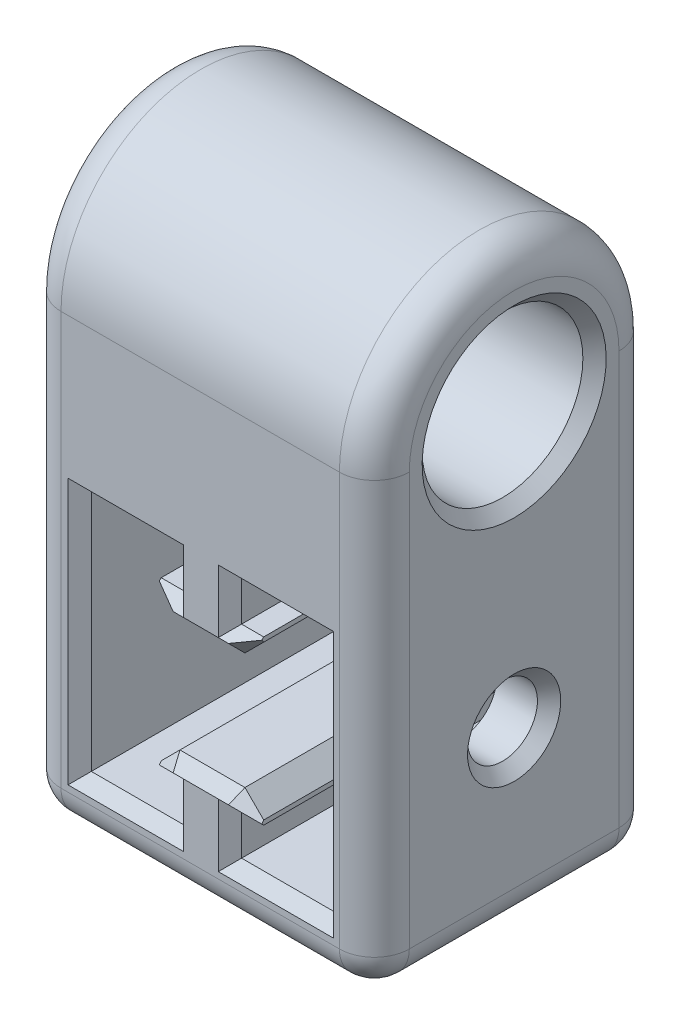
from build123d import *

# Parameters (mm, degrees)
BOSS_EXTRUDE1_DEPTH = 24
SKETCH5_R           = 6.9
BOSS_EXTRUDE3_DEPTH = 29.899298
SKETCH3_R           = 3
CUT_EXTRUDE1_DEPTH  = 53.251488462
SKETCH6_R           = 12
SKETCH6_R_2         = 5
BOSS_EXTRUDE4_DEPTH = 4
FILLET1_R           = 3
CHAMFER1_SIZE       = 1


with BuildPart() as part:
    # Sketch1 → Boss-Extrude1 (new body)
    with BuildSketch(Plane.XY):
        Polygon((0, 15), (14.899298428, 15), (14.899298428, -14.949649214), (-15, -14.949649214), (-15, 15), align=None)
        Polygon((-10.4, 10.4), (-2.5, 10.4), (-2.5, 7), (-4.4, 7), (-4.4, 6.61), (-2.79, 5), (2.79, 5), (4.4, 6.61), (4.4, 7), (2.5, 7), (2.5, 10.4), (10.4, 10.4), (10.4, 2.933567191), (10.4, -2.933567191), (10.4, -10.4), (2.5, -10.4), (2.5, -7), (4.4, -7), (4.4, -6.61), (2.79, -5), (-2.79, -5), (-4.4, -6.61), (-4.4, -7), (-2.5, -7), (-2.5, -10.4), (-10.4, -10.4), (-10.4, -2.933567191), (-10.4, -2.61), (-10.4, 2.933567191), align=None, mode=Mode.SUBTRACT)
    extrude(amount=BOSS_EXTRUDE1_DEPTH)

    # Sketch5 → Boss-Extrude3 (add, through all)
    with BuildSketch(Plane.ZY.offset(15)):
        with BuildLine():
            Line((0, 15), (24, 15))
            Line((24, 15), (24, 23.5))
            ThreePointArc((24, 23.5), (12, 35.5), (0, 23.5))
            Line((0, 23.5), (0, 15))
        make_face()
        with Locations((12, 23.5)):
            Circle(SKETCH5_R, mode=Mode.SUBTRACT)
    extrude(amount=-BOSS_EXTRUDE3_DEPTH)

    # Sketch3 → Cut-Extrude1 (cut, through all)
    with BuildSketch(Plane.ZY.offset(15)):
        with Locations((12, 0)):
            Circle(SKETCH3_R)
    extrude(amount=-CUT_EXTRUDE1_DEPTH, mode=Mode.SUBTRACT)

    # Sketch6 → Boss-Extrude4 (add)
    with BuildSketch(Plane.ZY.offset(15)):
        with Locations((12, 23.5)):
            Circle(SKETCH6_R)
        with Locations((12, 23.5)):
            Circle(SKETCH6_R_2, mode=Mode.SUBTRACT)
    extrude(amount=-BOSS_EXTRUDE4_DEPTH)

    # Fillet1
    fillet1_edges = [part.edges().sort_by_distance(p)[0] for p in [
        (-0.050350786, -14.949649214, 24),
        (14.899298428, 0.025175393, 24),
        (14.899298428, 0.025175393, 0),
        (-0.050350786, -14.949649214, 0),
        (-15, 4.275175393, 0),
        (-15, 4.275175393, 24),
        (14.899298428, -14.949649214, 12),
        (-15, -14.949649214, 12),
        (14.899298, 35.5, 12),
        (-15, 35.5, 12),
    ]]
    fillet(fillet1_edges, radius=FILLET1_R)

    # Chamfer1
    # the kernel refuses this chamfer: 1 mm, written as the material it takes off along each edge
    with BuildSketch(Plane(origin=(-15, 0, 12), x_dir=(0, 0, 1), z_dir=(0, -1, 0))) as chamfer1_piece_1:
        Polygon((3 + CHAMFER1_SIZE, 0), (3, -CHAMFER1_SIZE), (3, 0), align=None)
    revolve(axis=Axis((-15, 0, 12), (-1, 0, 0)), mode=Mode.SUBTRACT)
    with BuildSketch(Plane(origin=(14.899298428, 0, 12), x_dir=(0, 0, 1), z_dir=(0, -1, 0))) as chamfer1_piece_2:
        Polygon((3 + CHAMFER1_SIZE, 0), (3, CHAMFER1_SIZE), (3, 0), align=None)
    revolve(axis=Axis((14.899298428, 0, 12), (-1, 0, 0)), mode=Mode.SUBTRACT)
    with BuildSketch(Plane(origin=(14.899298, 23.5, 12), x_dir=(0, 0, 1), z_dir=(0, -1, 0))) as chamfer1_piece_3:
        Polygon((6.9 + CHAMFER1_SIZE, 0), (6.9, CHAMFER1_SIZE), (6.9, 0), align=None)
    revolve(axis=Axis((14.899298, 23.5, 12), (-1, 0, 0)), mode=Mode.SUBTRACT)
    with BuildSketch(Plane(origin=(-6.21845448, 8.42845448, 0), x_dir=(-0.019442520806012883, -0.01944252080601297, 0.9996219169112968), z_dir=(0.7071067811865491, -0.707106781186546, 0)), Plane(origin=(0.97154552, 3.18154552, 0), x_dir=(0.01944252080601412, -0.019442520806014222, 0.9996219169112968), z_dir=(0.7071067811865493, 0.7071067811865458, 0)), Plane(origin=(6.21845448, -8.42845448, 0), x_dir=(0.019442520806013733, 0.019442520806013854, 0.9996219169112968), z_dir=(-0.7071067811865498, 0.7071067811865452, 0)), Plane(origin=(-0.97154552, -3.18154552, 0), x_dir=(-0.019442520806014107, 0.019442520806014236, 0.9996219169112968), z_dir=(-0.7071067811865498, -0.7071067811865452, 0)), Plane(origin=(-0.97154552, -3.18154552, 24), x_dir=(0.7068394360706712, -0.7068394360706757, 0.02749587661058563), z_dir=(-0.7071067811865498, -0.7071067811865452, 0)), Plane(origin=(6.21845448, -8.42845448, 24), x_dir=(-0.7068394360706712, -0.7068394360706758, 0.027495876610585647), z_dir=(-0.7071067811865498, 0.7071067811865452, 0)), Plane(origin=(0.97154552, 3.18154552, 24), x_dir=(-0.7068394360706717, 0.7068394360706753, 0.02749587661058563), z_dir=(0.7071067811865493, 0.7071067811865458, 0)), Plane(origin=(-6.21845448, 8.42845448, 24), x_dir=(0.706839436070672, 0.706839436070675, 0.02749587661058563), z_dir=(0.7071067811865491, -0.707106781186546, 0))) as chamfer1_piece_4:
        Polygon((CHAMFER1_SIZE * 0.999621916911, -CHAMFER1_SIZE * 0.0274958766106), (-CHAMFER1_SIZE * 0.0274958766106, -CHAMFER1_SIZE * 0.999621916911), (0, 0), align=None)
    extrude(amount=7.420249811, mode=Mode.SUBTRACT)
    with BuildSketch(Plane(origin=(-5.361682988, 5, 0), x_dir=(0, -0.027495876610586494, 0.9996219169112968), z_dir=(1, 0, 0)), Plane(origin=(5.361682988, -5, 0), x_dir=(0, 0.027495876610586494, 0.9996219169112968), z_dir=(-1, 0, 0)), Plane(origin=(5.361682988, -5, 24), x_dir=(0, -0.9996219169112968, 0.027495876610585623), z_dir=(-1, 0, 0)), Plane(origin=(-5.361682988, 5, 24), x_dir=(0, 0.9996219169112968, 0.027495876610585623), z_dir=(1, 0, 0))) as chamfer1_piece_5:
        Polygon((CHAMFER1_SIZE * 0.999621916911, -CHAMFER1_SIZE * 0.0274958766106), (-CHAMFER1_SIZE * 0.0274958766106, -CHAMFER1_SIZE * 0.999621916911), (0, 0), align=None)
    extrude(amount=10.723365976, mode=Mode.SUBTRACT)
    with BuildSketch(Plane(origin=(6.971682988, 7, 0), x_dir=(0, 0.027495876610586494, 0.9996219169112968), z_dir=(-1, 0, 0)), Plane(origin=(2.5, -7, 0), x_dir=(0, -0.027495876610586494, 0.9996219169112968), z_dir=(1, 0, 0)), Plane(origin=(-6.971682988, -7, 0), x_dir=(0, -0.027495876610586494, 0.9996219169112968), z_dir=(1, 0, 0)), Plane(origin=(-2.5, 7, 0), x_dir=(0, 0.027495876610586494, 0.9996219169112968), z_dir=(-1, 0, 0)), Plane(origin=(-6.971682988, -7, 24), x_dir=(1.4018567596735031e-15, 0.9996219169112968, 0.027495876610585623), z_dir=(1, 0, 0)), Plane(origin=(2.5, -7, 24), x_dir=(-1.4018567596735031e-15, 0.9996219169112968, 0.027495876610585623), z_dir=(1, 0, 0)), Plane(origin=(6.971682988, 7, 24), x_dir=(0, -0.9996219169112968, 0.027495876610585623), z_dir=(-1, 0, 0)), Plane(origin=(-2.5, 7, 24), x_dir=(0, -0.9996219169112968, 0.027495876610585623), z_dir=(-1, 0, 0))) as chamfer1_piece_6:
        Polygon((CHAMFER1_SIZE * 0.999621916911, -CHAMFER1_SIZE * 0.0274958766106), (-CHAMFER1_SIZE * 0.0274958766106, -CHAMFER1_SIZE * 0.999621916911), (0, 0), align=None)
    extrude(amount=4.471682988, mode=Mode.SUBTRACT)
    with BuildSketch(Plane(origin=(2.5, 7, 0), x_dir=(0.027495876610586494, 0, 0.9996219169112968), z_dir=(0, 1, 0)), Plane(origin=(2.5, -10.4, 0), x_dir=(0.027495876610586494, 0, 0.9996219169112968), z_dir=(0, 1, 0)), Plane(origin=(-2.5, -7, 0), x_dir=(-0.027495876610586494, 0, 0.9996219169112968), z_dir=(0, -1, 0)), Plane(origin=(-2.5, 10.4, 0), x_dir=(-0.027495876610586494, 0, 0.9996219169112968), z_dir=(0, -1, 0)), Plane(origin=(-2.5, 10.4, 24), x_dir=(0.9996219169112968, 1.5145550481962746e-14, 0.02749587661058563), z_dir=(0, -1, 0)), Plane(origin=(-2.5, -7, 24), x_dir=(0.9996219169112968, 1.488442030123925e-14, 0.02749587661058563), z_dir=(0, -1, 0)), Plane(origin=(2.5, -10.4, 24), x_dir=(-0.9996219169112968, 1.488442030123925e-14, 0.02749587661058563), z_dir=(0, 1, 0)), Plane(origin=(2.5, 7, 24), x_dir=(-0.9996219169112968, -1.5145550481962746e-14, 0.02749587661058563), z_dir=(0, 1, 0))) as chamfer1_piece_7:
        Polygon((CHAMFER1_SIZE * 0.999621916911, -CHAMFER1_SIZE * 0.0274958766106), (-CHAMFER1_SIZE * 0.0274958766106, -CHAMFER1_SIZE * 0.999621916911), (0, 0), align=None)
    extrude(amount=3.4, mode=Mode.SUBTRACT)
    with BuildSketch(Plane(origin=(2.5, 10.4, 0), x_dir=(0, -0.02749587661058563, 0.9996219169112968), z_dir=(1, 0, 0)), Plane(origin=(10.4, -10.4, 0), x_dir=(0, 0.02749587661058563, 0.9996219169112968), z_dir=(-1, 0, 0)), Plane(origin=(-2.5, -10.4, 0), x_dir=(0, 0.02749587661058563, 0.9996219169112968), z_dir=(-1, 0, 0)), Plane(origin=(-10.4, 10.4, 0), x_dir=(0, -0.02749587661058563, 0.9996219169112968), z_dir=(1, 0, 0)), Plane(origin=(-10.4, 10.4, 24), x_dir=(0, 0.9996219169112968, 0.027495876610585647), z_dir=(1, 0, 0)), Plane(origin=(-2.5, -10.4, 24), x_dir=(0, -0.9996219169112968, 0.027495876610585647), z_dir=(-1, 0, 0)), Plane(origin=(10.4, -10.4, 24), x_dir=(0, -0.9996219169112968, 0.027495876610585647), z_dir=(-1, 0, 0)), Plane(origin=(2.5, 10.4, 24), x_dir=(0, 0.9996219169112968, 0.027495876610585647), z_dir=(1, 0, 0))) as chamfer1_piece_8:
        Polygon((CHAMFER1_SIZE * 0.999621916911, -CHAMFER1_SIZE * 0.0274958766106), (-CHAMFER1_SIZE * 0.0274958766106, -CHAMFER1_SIZE * 0.999621916911), (0, 0), align=None)
    extrude(amount=7.9, mode=Mode.SUBTRACT)
    with BuildSketch(Plane(origin=(10.4, 10.4, 0), x_dir=(-0.02749587661058908, 0, 0.9996219169112968), z_dir=(0, -1, 0)), Plane(origin=(-10.4, -10.4, 0), x_dir=(0.027495876610587354, 0, 0.9996219169112968), z_dir=(0, 1, 0))) as chamfer1_piece_9:
        Polygon((CHAMFER1_SIZE * 0.999621916911, -CHAMFER1_SIZE * 0.0274958766106), (-CHAMFER1_SIZE * 0.0274958766106, -CHAMFER1_SIZE * 0.999621916911), (0, 0), align=None)
    extrude(amount=20.8, mode=Mode.SUBTRACT)
    with BuildSketch(Plane(origin=(-10.4, 10.4, 24), x_dir=(-0.9996219169112968, 0, 0.027495876610585647), z_dir=(0, -1, 0)), Plane(origin=(10.4, -10.4, 24), x_dir=(0.9996219169112968, 0, 0.027495876610585647), z_dir=(0, 1, 0))) as chamfer1_piece_10:
        Polygon((CHAMFER1_SIZE * 0.999621916911, CHAMFER1_SIZE * 0.0274958766106), (-CHAMFER1_SIZE * 0.0274958766106, CHAMFER1_SIZE * 0.999621916911), (0, 0), align=None)
    extrude(amount=20.8, mode=Mode.SUBTRACT)
    with BuildSketch(Plane(origin=(-15, 23.5, 12), x_dir=(0, 0, 1), z_dir=(0, -1, 0))) as chamfer1_piece_11:
        Polygon((5 + CHAMFER1_SIZE, 0), (5, -CHAMFER1_SIZE), (5, 0), align=None)
    revolve(axis=Axis((-15, 23.5, 12), (-1, 0, 0)), mode=Mode.SUBTRACT)
    with BuildSketch(Plane(origin=(2.5, 4.428317012, 0), x_dir=(0.027495876610586494, 0, 0.9996219169112968), z_dir=(0, 1, 0))) as chamfer1_piece_12a_section:
        Polygon((CHAMFER1_SIZE * 0.999621916911, -CHAMFER1_SIZE * 0.0274958766106), (-CHAMFER1_SIZE * 0.0274958766106, -CHAMFER1_SIZE * 0.999621916911), (0, 0), align=None)
    chamfer1_piece_12a = extrude(amount=5.971682988, mode=Mode.PRIVATE)
    chamfer1_piece_12a = split(chamfer1_piece_12a, bisect_by=Plane(origin=(2.170206373, 7, 0.329793627), z_dir=(0, -1, 0)), keep=Keep.TOP, mode=Mode.PRIVATE)
    with BuildSketch(Plane(origin=(6.971682988, 7, 0), x_dir=(0, 0.027495876610586494, 0.9996219169112968), z_dir=(-1, 0, 0))) as chamfer1_piece_12b_section:
        Polygon((CHAMFER1_SIZE * 0.999621916911, -CHAMFER1_SIZE * 0.0274958766106), (-CHAMFER1_SIZE * 0.0274958766106, -CHAMFER1_SIZE * 0.999621916911), (0, 0), align=None)
    chamfer1_piece_12b = extrude(amount=7.043365976, mode=Mode.PRIVATE)
    chamfer1_piece_12b = split(chamfer1_piece_12b, bisect_by=Plane(origin=(2.5, 6.670206373, 0.329793627), z_dir=(-1, 0, 0)), keep=Keep.TOP, mode=Mode.PRIVATE)
    chamfer1_piece_12 = chamfer1_piece_12a & chamfer1_piece_12b
    add(chamfer1_piece_12, mode=Mode.SUBTRACT)
    with BuildSketch(Plane(origin=(-0.071682988, 10.4, 0), x_dir=(0, -0.02749587661058563, 0.9996219169112968), z_dir=(1, 0, 0))) as chamfer1_piece_13a_section:
        Polygon((CHAMFER1_SIZE * 0.999621916911, -CHAMFER1_SIZE * 0.0274958766106), (-CHAMFER1_SIZE * 0.0274958766106, -CHAMFER1_SIZE * 0.999621916911), (0, 0), align=None)
    chamfer1_piece_13a = extrude(amount=10.471682988, mode=Mode.PRIVATE)
    chamfer1_piece_13a = split(chamfer1_piece_13a, bisect_by=Plane(origin=(2.5, 10.729793627, 0.329793627), z_dir=(-1, 0, 0)), keep=Keep.TOP, mode=Mode.PRIVATE)
    with BuildSketch(Plane(origin=(2.5, 7, 0), x_dir=(0.027495876610586494, 0, 0.9996219169112968), z_dir=(0, 1, 0))) as chamfer1_piece_13b_section:
        Polygon((CHAMFER1_SIZE * 0.999621916911, -CHAMFER1_SIZE * 0.0274958766106), (-CHAMFER1_SIZE * 0.0274958766106, -CHAMFER1_SIZE * 0.999621916911), (0, 0), align=None)
    chamfer1_piece_13b = extrude(amount=5.971682988, mode=Mode.PRIVATE)
    chamfer1_piece_13b = split(chamfer1_piece_13b, bisect_by=Plane(origin=(2.170206373, 10.4, 0.329793627), z_dir=(0, 1, 0)), keep=Keep.TOP, mode=Mode.PRIVATE)
    chamfer1_piece_13 = chamfer1_piece_13a & chamfer1_piece_13b
    add(chamfer1_piece_13, mode=Mode.SUBTRACT)
    with BuildSketch(Plane(origin=(10.4, 12.971682988, 0), x_dir=(-0.02749587661058563, 0, 0.9996219169112968), z_dir=(0, -1, 0))) as chamfer1_piece_14a_section:
        Polygon((CHAMFER1_SIZE * 0.999621916911, -CHAMFER1_SIZE * 0.0274958766106), (-CHAMFER1_SIZE * 0.0274958766106, -CHAMFER1_SIZE * 0.999621916911), (0, 0), align=None)
    chamfer1_piece_14a = extrude(amount=23.371682988, mode=Mode.PRIVATE)
    chamfer1_piece_14a = split(chamfer1_piece_14a, bisect_by=Plane(origin=(10.729793627, 10.4, 0.329793627), z_dir=(0, 1, 0)), keep=Keep.TOP, mode=Mode.PRIVATE)
    with BuildSketch(Plane(origin=(2.5, 10.4, 0), x_dir=(0, -0.02749587661058563, 0.9996219169112968), z_dir=(1, 0, 0))) as chamfer1_piece_14b_section:
        Polygon((CHAMFER1_SIZE * 0.999621916911, -CHAMFER1_SIZE * 0.0274958766106), (-CHAMFER1_SIZE * 0.0274958766106, -CHAMFER1_SIZE * 0.999621916911), (0, 0), align=None)
    chamfer1_piece_14b = extrude(amount=10.471682988, mode=Mode.PRIVATE)
    chamfer1_piece_14b = split(chamfer1_piece_14b, bisect_by=Plane(origin=(10.4, 10.729793627, 0.329793627), z_dir=(1, 0, 0)), keep=Keep.TOP, mode=Mode.PRIVATE)
    chamfer1_piece_14 = chamfer1_piece_14a & chamfer1_piece_14b
    add(chamfer1_piece_14, mode=Mode.SUBTRACT)
    with BuildSketch(Plane(origin=(12.971682988, -10.4, 0), x_dir=(0, 0.02749587661058563, 0.9996219169112968), z_dir=(-1, 0, 0))) as chamfer1_piece_15a_section:
        Polygon((CHAMFER1_SIZE * 0.999621916911, -CHAMFER1_SIZE * 0.0274958766106), (-CHAMFER1_SIZE * 0.0274958766106, -CHAMFER1_SIZE * 0.999621916911), (0, 0), align=None)
    chamfer1_piece_15a = extrude(amount=10.471682988, mode=Mode.PRIVATE)
    chamfer1_piece_15a = split(chamfer1_piece_15a, bisect_by=Plane(origin=(10.4, -10.729793627, 0.329793627), z_dir=(1, 0, 0)), keep=Keep.TOP, mode=Mode.PRIVATE)
    with BuildSketch(Plane(origin=(10.4, 10.4, 0), x_dir=(-0.02749587661058908, 0, 0.9996219169112968), z_dir=(0, -1, 0))) as chamfer1_piece_15b_section:
        Polygon((CHAMFER1_SIZE * 0.999621916911, -CHAMFER1_SIZE * 0.0274958766106), (-CHAMFER1_SIZE * 0.0274958766106, -CHAMFER1_SIZE * 0.999621916911), (0, 0), align=None)
    chamfer1_piece_15b = extrude(amount=23.371682988, mode=Mode.PRIVATE)
    chamfer1_piece_15b = split(chamfer1_piece_15b, bisect_by=Plane(origin=(10.729793627, -10.4, 0.329793627), z_dir=(0, -1, 0)), keep=Keep.TOP, mode=Mode.PRIVATE)
    chamfer1_piece_15 = chamfer1_piece_15a & chamfer1_piece_15b
    add(chamfer1_piece_15, mode=Mode.SUBTRACT)
    with BuildSketch(Plane(origin=(2.5, -12.971682988, 0), x_dir=(0.027495876610586494, 0, 0.9996219169112968), z_dir=(0, 1, 0))) as chamfer1_piece_16a_section:
        Polygon((CHAMFER1_SIZE * 0.999621916911, -CHAMFER1_SIZE * 0.0274958766106), (-CHAMFER1_SIZE * 0.0274958766106, -CHAMFER1_SIZE * 0.999621916911), (0, 0), align=None)
    chamfer1_piece_16a = extrude(amount=5.971682988, mode=Mode.PRIVATE)
    chamfer1_piece_16a = split(chamfer1_piece_16a, bisect_by=Plane(origin=(2.170206373, -10.4, 0.329793627), z_dir=(0, -1, 0)), keep=Keep.TOP, mode=Mode.PRIVATE)
    with BuildSketch(Plane(origin=(10.4, -10.4, 0), x_dir=(0, 0.02749587661058563, 0.9996219169112968), z_dir=(-1, 0, 0))) as chamfer1_piece_16b_section:
        Polygon((CHAMFER1_SIZE * 0.999621916911, -CHAMFER1_SIZE * 0.0274958766106), (-CHAMFER1_SIZE * 0.0274958766106, -CHAMFER1_SIZE * 0.999621916911), (0, 0), align=None)
    chamfer1_piece_16b = extrude(amount=10.471682988, mode=Mode.PRIVATE)
    chamfer1_piece_16b = split(chamfer1_piece_16b, bisect_by=Plane(origin=(2.5, -10.729793627, 0.329793627), z_dir=(-1, 0, 0)), keep=Keep.TOP, mode=Mode.PRIVATE)
    chamfer1_piece_16 = chamfer1_piece_16a & chamfer1_piece_16b
    add(chamfer1_piece_16, mode=Mode.SUBTRACT)
    with BuildSketch(Plane(origin=(-0.071682988, -7, 0), x_dir=(0, -0.027495876610586494, 0.9996219169112968), z_dir=(1, 0, 0))) as chamfer1_piece_17a_section:
        Polygon((CHAMFER1_SIZE * 0.999621916911, -CHAMFER1_SIZE * 0.0274958766106), (-CHAMFER1_SIZE * 0.0274958766106, -CHAMFER1_SIZE * 0.999621916911), (0, 0), align=None)
    chamfer1_piece_17a = extrude(amount=7.043365976, mode=Mode.PRIVATE)
    chamfer1_piece_17a = split(chamfer1_piece_17a, bisect_by=Plane(origin=(2.5, -6.670206373, 0.329793627), z_dir=(-1, 0, 0)), keep=Keep.TOP, mode=Mode.PRIVATE)
    with BuildSketch(Plane(origin=(2.5, -10.4, 0), x_dir=(0.027495876610586494, 0, 0.9996219169112968), z_dir=(0, 1, 0))) as chamfer1_piece_17b_section:
        Polygon((CHAMFER1_SIZE * 0.999621916911, -CHAMFER1_SIZE * 0.0274958766106), (-CHAMFER1_SIZE * 0.0274958766106, -CHAMFER1_SIZE * 0.999621916911), (0, 0), align=None)
    chamfer1_piece_17b = extrude(amount=5.971682988, mode=Mode.PRIVATE)
    chamfer1_piece_17b = split(chamfer1_piece_17b, bisect_by=Plane(origin=(2.170206373, -7, 0.329793627), z_dir=(0, 1, 0)), keep=Keep.TOP, mode=Mode.PRIVATE)
    chamfer1_piece_17 = chamfer1_piece_17a & chamfer1_piece_17b
    add(chamfer1_piece_17, mode=Mode.SUBTRACT)
    with BuildSketch(Plane(origin=(-2.5, -4.428317012, 0), x_dir=(-0.027495876610586494, 0, 0.9996219169112968), z_dir=(0, -1, 0))) as chamfer1_piece_18a_section:
        Polygon((CHAMFER1_SIZE * 0.999621916911, -CHAMFER1_SIZE * 0.0274958766106), (-CHAMFER1_SIZE * 0.0274958766106, -CHAMFER1_SIZE * 0.999621916911), (0, 0), align=None)
    chamfer1_piece_18a = extrude(amount=5.971682988, mode=Mode.PRIVATE)
    chamfer1_piece_18a = split(chamfer1_piece_18a, bisect_by=Plane(origin=(-2.170206373, -7, 0.329793627), z_dir=(0, 1, 0)), keep=Keep.TOP, mode=Mode.PRIVATE)
    with BuildSketch(Plane(origin=(-6.971682988, -7, 0), x_dir=(0, -0.027495876610586494, 0.9996219169112968), z_dir=(1, 0, 0))) as chamfer1_piece_18b_section:
        Polygon((CHAMFER1_SIZE * 0.999621916911, -CHAMFER1_SIZE * 0.0274958766106), (-CHAMFER1_SIZE * 0.0274958766106, -CHAMFER1_SIZE * 0.999621916911), (0, 0), align=None)
    chamfer1_piece_18b = extrude(amount=7.043365976, mode=Mode.PRIVATE)
    chamfer1_piece_18b = split(chamfer1_piece_18b, bisect_by=Plane(origin=(-2.5, -6.670206373, 0.329793627), z_dir=(1, 0, 0)), keep=Keep.TOP, mode=Mode.PRIVATE)
    chamfer1_piece_18 = chamfer1_piece_18a & chamfer1_piece_18b
    add(chamfer1_piece_18, mode=Mode.SUBTRACT)
    with BuildSketch(Plane(origin=(0.071682988, -10.4, 0), x_dir=(0, 0.02749587661058563, 0.9996219169112968), z_dir=(-1, 0, 0))) as chamfer1_piece_19a_section:
        Polygon((CHAMFER1_SIZE * 0.999621916911, -CHAMFER1_SIZE * 0.0274958766106), (-CHAMFER1_SIZE * 0.0274958766106, -CHAMFER1_SIZE * 0.999621916911), (0, 0), align=None)
    chamfer1_piece_19a = extrude(amount=10.471682988, mode=Mode.PRIVATE)
    chamfer1_piece_19a = split(chamfer1_piece_19a, bisect_by=Plane(origin=(-2.5, -10.729793627, 0.329793627), z_dir=(1, 0, 0)), keep=Keep.TOP, mode=Mode.PRIVATE)
    with BuildSketch(Plane(origin=(-2.5, -7, 0), x_dir=(-0.027495876610586494, 0, 0.9996219169112968), z_dir=(0, -1, 0))) as chamfer1_piece_19b_section:
        Polygon((CHAMFER1_SIZE * 0.999621916911, -CHAMFER1_SIZE * 0.0274958766106), (-CHAMFER1_SIZE * 0.0274958766106, -CHAMFER1_SIZE * 0.999621916911), (0, 0), align=None)
    chamfer1_piece_19b = extrude(amount=5.971682988, mode=Mode.PRIVATE)
    chamfer1_piece_19b = split(chamfer1_piece_19b, bisect_by=Plane(origin=(-2.170206373, -10.4, 0.329793627), z_dir=(0, -1, 0)), keep=Keep.TOP, mode=Mode.PRIVATE)
    chamfer1_piece_19 = chamfer1_piece_19a & chamfer1_piece_19b
    add(chamfer1_piece_19, mode=Mode.SUBTRACT)
    with BuildSketch(Plane(origin=(-10.4, -12.971682988, 0), x_dir=(0.02749587661058563, 0, 0.9996219169112968), z_dir=(0, 1, 0))) as chamfer1_piece_20a_section:
        Polygon((CHAMFER1_SIZE * 0.999621916911, -CHAMFER1_SIZE * 0.0274958766106), (-CHAMFER1_SIZE * 0.0274958766106, -CHAMFER1_SIZE * 0.999621916911), (0, 0), align=None)
    chamfer1_piece_20a = extrude(amount=23.371682988, mode=Mode.PRIVATE)
    chamfer1_piece_20a = split(chamfer1_piece_20a, bisect_by=Plane(origin=(-10.729793627, -10.4, 0.329793627), z_dir=(0, -1, 0)), keep=Keep.TOP, mode=Mode.PRIVATE)
    with BuildSketch(Plane(origin=(-2.5, -10.4, 0), x_dir=(0, 0.02749587661058563, 0.9996219169112968), z_dir=(-1, 0, 0))) as chamfer1_piece_20b_section:
        Polygon((CHAMFER1_SIZE * 0.999621916911, -CHAMFER1_SIZE * 0.0274958766106), (-CHAMFER1_SIZE * 0.0274958766106, -CHAMFER1_SIZE * 0.999621916911), (0, 0), align=None)
    chamfer1_piece_20b = extrude(amount=10.471682988, mode=Mode.PRIVATE)
    chamfer1_piece_20b = split(chamfer1_piece_20b, bisect_by=Plane(origin=(-10.4, -10.729793627, 0.329793627), z_dir=(-1, 0, 0)), keep=Keep.TOP, mode=Mode.PRIVATE)
    chamfer1_piece_20 = chamfer1_piece_20a & chamfer1_piece_20b
    add(chamfer1_piece_20, mode=Mode.SUBTRACT)
    with BuildSketch(Plane(origin=(-10.4, -10.4, 0), x_dir=(0.027495876610587354, 0, 0.9996219169112968), z_dir=(0, 1, 0))) as chamfer1_piece_21a_section:
        Polygon((CHAMFER1_SIZE * 0.999621916911, -CHAMFER1_SIZE * 0.0274958766106), (-CHAMFER1_SIZE * 0.0274958766106, -CHAMFER1_SIZE * 0.999621916911), (0, 0), align=None)
    chamfer1_piece_21a = extrude(amount=23.371682988, mode=Mode.PRIVATE)
    chamfer1_piece_21a = split(chamfer1_piece_21a, bisect_by=Plane(origin=(-10.729793627, 10.4, 0.329793627), z_dir=(0, 1, 0)), keep=Keep.TOP, mode=Mode.PRIVATE)
    with BuildSketch(Plane(origin=(-12.971682988, 10.4, 0), x_dir=(0, -0.02749587661058563, 0.9996219169112968), z_dir=(1, 0, 0))) as chamfer1_piece_21b_section:
        Polygon((CHAMFER1_SIZE * 0.999621916911, -CHAMFER1_SIZE * 0.0274958766106), (-CHAMFER1_SIZE * 0.0274958766106, -CHAMFER1_SIZE * 0.999621916911), (0, 0), align=None)
    chamfer1_piece_21b = extrude(amount=10.471682988, mode=Mode.PRIVATE)
    chamfer1_piece_21b = split(chamfer1_piece_21b, bisect_by=Plane(origin=(-10.4, 10.729793627, 0.329793627), z_dir=(-1, 0, 0)), keep=Keep.TOP, mode=Mode.PRIVATE)
    chamfer1_piece_21 = chamfer1_piece_21a & chamfer1_piece_21b
    add(chamfer1_piece_21, mode=Mode.SUBTRACT)
    with BuildSketch(Plane(origin=(-2.5, 12.971682988, 0), x_dir=(-0.027495876610586494, 0, 0.9996219169112968), z_dir=(0, -1, 0))) as chamfer1_piece_22a_section:
        Polygon((CHAMFER1_SIZE * 0.999621916911, -CHAMFER1_SIZE * 0.0274958766106), (-CHAMFER1_SIZE * 0.0274958766106, -CHAMFER1_SIZE * 0.999621916911), (0, 0), align=None)
    chamfer1_piece_22a = extrude(amount=5.971682988, mode=Mode.PRIVATE)
    chamfer1_piece_22a = split(chamfer1_piece_22a, bisect_by=Plane(origin=(-2.170206373, 10.4, 0.329793627), z_dir=(0, 1, 0)), keep=Keep.TOP, mode=Mode.PRIVATE)
    with BuildSketch(Plane(origin=(-10.4, 10.4, 0), x_dir=(0, -0.02749587661058563, 0.9996219169112968), z_dir=(1, 0, 0))) as chamfer1_piece_22b_section:
        Polygon((CHAMFER1_SIZE * 0.999621916911, -CHAMFER1_SIZE * 0.0274958766106), (-CHAMFER1_SIZE * 0.0274958766106, -CHAMFER1_SIZE * 0.999621916911), (0, 0), align=None)
    chamfer1_piece_22b = extrude(amount=10.471682988, mode=Mode.PRIVATE)
    chamfer1_piece_22b = split(chamfer1_piece_22b, bisect_by=Plane(origin=(-2.5, 10.729793627, 0.329793627), z_dir=(1, 0, 0)), keep=Keep.TOP, mode=Mode.PRIVATE)
    chamfer1_piece_22 = chamfer1_piece_22a & chamfer1_piece_22b
    add(chamfer1_piece_22, mode=Mode.SUBTRACT)
    with BuildSketch(Plane(origin=(0.071682988, 7, 0), x_dir=(0, 0.027495876610586494, 0.9996219169112968), z_dir=(-1, 0, 0))) as chamfer1_piece_23a_section:
        Polygon((CHAMFER1_SIZE * 0.999621916911, -CHAMFER1_SIZE * 0.0274958766106), (-CHAMFER1_SIZE * 0.0274958766106, -CHAMFER1_SIZE * 0.999621916911), (0, 0), align=None)
    chamfer1_piece_23a = extrude(amount=7.043365976, mode=Mode.PRIVATE)
    chamfer1_piece_23a = split(chamfer1_piece_23a, bisect_by=Plane(origin=(-2.5, 6.670206373, 0.329793627), z_dir=(1, 0, 0)), keep=Keep.TOP, mode=Mode.PRIVATE)
    with BuildSketch(Plane(origin=(-2.5, 10.4, 0), x_dir=(-0.027495876610586494, 0, 0.9996219169112968), z_dir=(0, -1, 0))) as chamfer1_piece_23b_section:
        Polygon((CHAMFER1_SIZE * 0.999621916911, -CHAMFER1_SIZE * 0.0274958766106), (-CHAMFER1_SIZE * 0.0274958766106, -CHAMFER1_SIZE * 0.999621916911), (0, 0), align=None)
    chamfer1_piece_23b = extrude(amount=5.971682988, mode=Mode.PRIVATE)
    chamfer1_piece_23b = split(chamfer1_piece_23b, bisect_by=Plane(origin=(-2.170206373, 7, 0.329793627), z_dir=(0, -1, 0)), keep=Keep.TOP, mode=Mode.PRIVATE)
    chamfer1_piece_23 = chamfer1_piece_23a & chamfer1_piece_23b
    add(chamfer1_piece_23, mode=Mode.SUBTRACT)
    with BuildSketch(Plane(origin=(-2.5, 12.971682988, 24), x_dir=(0.9996219169112968, 1.5145550481962746e-14, 0.02749587661058563), z_dir=(0, -1, 0))) as chamfer1_piece_24a_section:
        Polygon((CHAMFER1_SIZE * 0.999621916911, -CHAMFER1_SIZE * 0.0274958766106), (-CHAMFER1_SIZE * 0.0274958766106, -CHAMFER1_SIZE * 0.999621916911), (0, 0), align=None)
    chamfer1_piece_24a = extrude(amount=5.971682988, mode=Mode.PRIVATE)
    chamfer1_piece_24a = split(chamfer1_piece_24a, bisect_by=Plane(origin=(-2.170206373, 10.4, 23.670206373), z_dir=(0, 1, 0)), keep=Keep.TOP, mode=Mode.PRIVATE)
    with BuildSketch(Plane(origin=(-10.4, 10.4, 24), x_dir=(0, 0.9996219169112968, 0.027495876610585647), z_dir=(1, 0, 0))) as chamfer1_piece_24b_section:
        Polygon((CHAMFER1_SIZE * 0.999621916911, -CHAMFER1_SIZE * 0.0274958766106), (-CHAMFER1_SIZE * 0.0274958766106, -CHAMFER1_SIZE * 0.999621916911), (0, 0), align=None)
    chamfer1_piece_24b = extrude(amount=10.471682988, mode=Mode.PRIVATE)
    chamfer1_piece_24b = split(chamfer1_piece_24b, bisect_by=Plane(origin=(-2.5, 10.729793627, 23.670206373), z_dir=(1, 0, 0)), keep=Keep.TOP, mode=Mode.PRIVATE)
    chamfer1_piece_24 = chamfer1_piece_24a & chamfer1_piece_24b
    add(chamfer1_piece_24, mode=Mode.SUBTRACT)
    with BuildSketch(Plane(origin=(0.071682988, 7, 24), x_dir=(0, -0.9996219169112968, 0.027495876610585623), z_dir=(-1, 0, 0))) as chamfer1_piece_25a_section:
        Polygon((CHAMFER1_SIZE * 0.999621916911, -CHAMFER1_SIZE * 0.0274958766106), (-CHAMFER1_SIZE * 0.0274958766106, -CHAMFER1_SIZE * 0.999621916911), (0, 0), align=None)
    chamfer1_piece_25a = extrude(amount=7.043365976, mode=Mode.PRIVATE)
    chamfer1_piece_25a = split(chamfer1_piece_25a, bisect_by=Plane(origin=(-2.5, 6.670206373, 23.670206373), z_dir=(1, 0, 0)), keep=Keep.TOP, mode=Mode.PRIVATE)
    with BuildSketch(Plane(origin=(-2.5, 10.4, 24), x_dir=(0.9996219169112968, 1.5145550481962746e-14, 0.02749587661058563), z_dir=(0, -1, 0))) as chamfer1_piece_25b_section:
        Polygon((CHAMFER1_SIZE * 0.999621916911, -CHAMFER1_SIZE * 0.0274958766106), (-CHAMFER1_SIZE * 0.0274958766106, -CHAMFER1_SIZE * 0.999621916911), (0, 0), align=None)
    chamfer1_piece_25b = extrude(amount=5.971682988, mode=Mode.PRIVATE)
    chamfer1_piece_25b = split(chamfer1_piece_25b, bisect_by=Plane(origin=(-2.170206373, 7, 23.670206373), z_dir=(0, -1, 0)), keep=Keep.TOP, mode=Mode.PRIVATE)
    chamfer1_piece_25 = chamfer1_piece_25a & chamfer1_piece_25b
    add(chamfer1_piece_25, mode=Mode.SUBTRACT)
    with BuildSketch(Plane(origin=(-10.4, 12.971682988, 24), x_dir=(-0.9996219169112968, 0, 0.027495876610585647), z_dir=(0, -1, 0))) as chamfer1_piece_26a_section:
        Polygon((CHAMFER1_SIZE * 0.999621916911, CHAMFER1_SIZE * 0.0274958766106), (-CHAMFER1_SIZE * 0.0274958766106, CHAMFER1_SIZE * 0.999621916911), (0, 0), align=None)
    chamfer1_piece_26a = extrude(amount=23.371682988, mode=Mode.PRIVATE)
    chamfer1_piece_26a = split(chamfer1_piece_26a, bisect_by=Plane(origin=(-10.729793627, 10.4, 23.670206373), z_dir=(0, 1, 0)), keep=Keep.TOP, mode=Mode.PRIVATE)
    with BuildSketch(Plane(origin=(-12.971682988, 10.4, 24), x_dir=(0, 0.9996219169112968, 0.027495876610585647), z_dir=(1, 0, 0))) as chamfer1_piece_26b_section:
        Polygon((CHAMFER1_SIZE * 0.999621916911, -CHAMFER1_SIZE * 0.0274958766106), (-CHAMFER1_SIZE * 0.0274958766106, -CHAMFER1_SIZE * 0.999621916911), (0, 0), align=None)
    chamfer1_piece_26b = extrude(amount=10.471682988, mode=Mode.PRIVATE)
    chamfer1_piece_26b = split(chamfer1_piece_26b, bisect_by=Plane(origin=(-10.4, 10.729793627, 23.670206373), z_dir=(-1, 0, 0)), keep=Keep.TOP, mode=Mode.PRIVATE)
    chamfer1_piece_26 = chamfer1_piece_26a & chamfer1_piece_26b
    add(chamfer1_piece_26, mode=Mode.SUBTRACT)
    with BuildSketch(Plane(origin=(-10.4, 10.4, 24), x_dir=(-0.9996219169112968, 0, 0.027495876610585647), z_dir=(0, -1, 0))) as chamfer1_piece_27a_section:
        Polygon((CHAMFER1_SIZE * 0.999621916911, CHAMFER1_SIZE * 0.0274958766106), (-CHAMFER1_SIZE * 0.0274958766106, CHAMFER1_SIZE * 0.999621916911), (0, 0), align=None)
    chamfer1_piece_27a = extrude(amount=23.371682988, mode=Mode.PRIVATE)
    chamfer1_piece_27a = split(chamfer1_piece_27a, bisect_by=Plane(origin=(-10.729793627, -10.4, 23.670206373), z_dir=(0, -1, 0)), keep=Keep.TOP, mode=Mode.PRIVATE)
    with BuildSketch(Plane(origin=(-2.5, -10.4, 24), x_dir=(0, -0.9996219169112968, 0.027495876610585647), z_dir=(-1, 0, 0))) as chamfer1_piece_27b_section:
        Polygon((CHAMFER1_SIZE * 0.999621916911, -CHAMFER1_SIZE * 0.0274958766106), (-CHAMFER1_SIZE * 0.0274958766106, -CHAMFER1_SIZE * 0.999621916911), (0, 0), align=None)
    chamfer1_piece_27b = extrude(amount=10.471682988, mode=Mode.PRIVATE)
    chamfer1_piece_27b = split(chamfer1_piece_27b, bisect_by=Plane(origin=(-10.4, -10.729793627, 23.670206373), z_dir=(-1, 0, 0)), keep=Keep.TOP, mode=Mode.PRIVATE)
    chamfer1_piece_27 = chamfer1_piece_27a & chamfer1_piece_27b
    add(chamfer1_piece_27, mode=Mode.SUBTRACT)
    with BuildSketch(Plane(origin=(0.071682988, -10.4, 24), x_dir=(0, -0.9996219169112968, 0.027495876610585647), z_dir=(-1, 0, 0))) as chamfer1_piece_28a_section:
        Polygon((CHAMFER1_SIZE * 0.999621916911, -CHAMFER1_SIZE * 0.0274958766106), (-CHAMFER1_SIZE * 0.0274958766106, -CHAMFER1_SIZE * 0.999621916911), (0, 0), align=None)
    chamfer1_piece_28a = extrude(amount=10.471682988, mode=Mode.PRIVATE)
    chamfer1_piece_28a = split(chamfer1_piece_28a, bisect_by=Plane(origin=(-2.5, -10.729793627, 23.670206373), z_dir=(1, 0, 0)), keep=Keep.TOP, mode=Mode.PRIVATE)
    with BuildSketch(Plane(origin=(-2.5, -7, 24), x_dir=(0.9996219169112968, 1.488442030123925e-14, 0.02749587661058563), z_dir=(0, -1, 0))) as chamfer1_piece_28b_section:
        Polygon((CHAMFER1_SIZE * 0.999621916911, -CHAMFER1_SIZE * 0.0274958766106), (-CHAMFER1_SIZE * 0.0274958766106, -CHAMFER1_SIZE * 0.999621916911), (0, 0), align=None)
    chamfer1_piece_28b = extrude(amount=5.971682988, mode=Mode.PRIVATE)
    chamfer1_piece_28b = split(chamfer1_piece_28b, bisect_by=Plane(origin=(-2.170206373, -10.4, 23.670206373), z_dir=(0, -1, 0)), keep=Keep.TOP, mode=Mode.PRIVATE)
    chamfer1_piece_28 = chamfer1_piece_28a & chamfer1_piece_28b
    add(chamfer1_piece_28, mode=Mode.SUBTRACT)
    with BuildSketch(Plane(origin=(-2.5, -4.428317012, 24), x_dir=(0.9996219169112968, 1.488442030123925e-14, 0.02749587661058563), z_dir=(0, -1, 0))) as chamfer1_piece_29a_section:
        Polygon((CHAMFER1_SIZE * 0.999621916911, -CHAMFER1_SIZE * 0.0274958766106), (-CHAMFER1_SIZE * 0.0274958766106, -CHAMFER1_SIZE * 0.999621916911), (0, 0), align=None)
    chamfer1_piece_29a = extrude(amount=5.971682988, mode=Mode.PRIVATE)
    chamfer1_piece_29a = split(chamfer1_piece_29a, bisect_by=Plane(origin=(-2.170206373, -7, 23.670206373), z_dir=(0, 1, 0)), keep=Keep.TOP, mode=Mode.PRIVATE)
    with BuildSketch(Plane(origin=(-6.971682988, -7, 24), x_dir=(1.4018567596735031e-15, 0.9996219169112968, 0.027495876610585623), z_dir=(1, 0, 0))) as chamfer1_piece_29b_section:
        Polygon((CHAMFER1_SIZE * 0.999621916911, -CHAMFER1_SIZE * 0.0274958766106), (-CHAMFER1_SIZE * 0.0274958766106, -CHAMFER1_SIZE * 0.999621916911), (0, 0), align=None)
    chamfer1_piece_29b = extrude(amount=7.043365976, mode=Mode.PRIVATE)
    chamfer1_piece_29b = split(chamfer1_piece_29b, bisect_by=Plane(origin=(-2.5, -6.670206373, 23.670206373), z_dir=(1, 0, 0)), keep=Keep.TOP, mode=Mode.PRIVATE)
    chamfer1_piece_29 = chamfer1_piece_29a & chamfer1_piece_29b
    add(chamfer1_piece_29, mode=Mode.SUBTRACT)
    with BuildSketch(Plane(origin=(-0.071682988, -7, 24), x_dir=(-1.4018567596735031e-15, 0.9996219169112968, 0.027495876610585623), z_dir=(1, 0, 0))) as chamfer1_piece_30a_section:
        Polygon((CHAMFER1_SIZE * 0.999621916911, -CHAMFER1_SIZE * 0.0274958766106), (-CHAMFER1_SIZE * 0.0274958766106, -CHAMFER1_SIZE * 0.999621916911), (0, 0), align=None)
    chamfer1_piece_30a = extrude(amount=7.043365976, mode=Mode.PRIVATE)
    chamfer1_piece_30a = split(chamfer1_piece_30a, bisect_by=Plane(origin=(2.5, -6.670206373, 23.670206373), z_dir=(-1, 0, 0)), keep=Keep.TOP, mode=Mode.PRIVATE)
    with BuildSketch(Plane(origin=(2.5, -10.4, 24), x_dir=(-0.9996219169112968, 1.488442030123925e-14, 0.02749587661058563), z_dir=(0, 1, 0))) as chamfer1_piece_30b_section:
        Polygon((CHAMFER1_SIZE * 0.999621916911, -CHAMFER1_SIZE * 0.0274958766106), (-CHAMFER1_SIZE * 0.0274958766106, -CHAMFER1_SIZE * 0.999621916911), (0, 0), align=None)
    chamfer1_piece_30b = extrude(amount=5.971682988, mode=Mode.PRIVATE)
    chamfer1_piece_30b = split(chamfer1_piece_30b, bisect_by=Plane(origin=(2.170206373, -7, 23.670206373), z_dir=(0, 1, 0)), keep=Keep.TOP, mode=Mode.PRIVATE)
    chamfer1_piece_30 = chamfer1_piece_30a & chamfer1_piece_30b
    add(chamfer1_piece_30, mode=Mode.SUBTRACT)
    with BuildSketch(Plane(origin=(2.5, -12.971682988, 24), x_dir=(-0.9996219169112968, 1.488442030123925e-14, 0.02749587661058563), z_dir=(0, 1, 0))) as chamfer1_piece_31a_section:
        Polygon((CHAMFER1_SIZE * 0.999621916911, -CHAMFER1_SIZE * 0.0274958766106), (-CHAMFER1_SIZE * 0.0274958766106, -CHAMFER1_SIZE * 0.999621916911), (0, 0), align=None)
    chamfer1_piece_31a = extrude(amount=5.971682988, mode=Mode.PRIVATE)
    chamfer1_piece_31a = split(chamfer1_piece_31a, bisect_by=Plane(origin=(2.170206373, -10.4, 23.670206373), z_dir=(0, -1, 0)), keep=Keep.TOP, mode=Mode.PRIVATE)
    with BuildSketch(Plane(origin=(10.4, -10.4, 24), x_dir=(0, -0.9996219169112968, 0.027495876610585647), z_dir=(-1, 0, 0))) as chamfer1_piece_31b_section:
        Polygon((CHAMFER1_SIZE * 0.999621916911, -CHAMFER1_SIZE * 0.0274958766106), (-CHAMFER1_SIZE * 0.0274958766106, -CHAMFER1_SIZE * 0.999621916911), (0, 0), align=None)
    chamfer1_piece_31b = extrude(amount=10.471682988, mode=Mode.PRIVATE)
    chamfer1_piece_31b = split(chamfer1_piece_31b, bisect_by=Plane(origin=(2.5, -10.729793627, 23.670206373), z_dir=(-1, 0, 0)), keep=Keep.TOP, mode=Mode.PRIVATE)
    chamfer1_piece_31 = chamfer1_piece_31a & chamfer1_piece_31b
    add(chamfer1_piece_31, mode=Mode.SUBTRACT)
    with BuildSketch(Plane(origin=(12.971682988, -10.4, 24), x_dir=(0, -0.9996219169112968, 0.027495876610585647), z_dir=(-1, 0, 0))) as chamfer1_piece_32a_section:
        Polygon((CHAMFER1_SIZE * 0.999621916911, -CHAMFER1_SIZE * 0.0274958766106), (-CHAMFER1_SIZE * 0.0274958766106, -CHAMFER1_SIZE * 0.999621916911), (0, 0), align=None)
    chamfer1_piece_32a = extrude(amount=10.471682988, mode=Mode.PRIVATE)
    chamfer1_piece_32a = split(chamfer1_piece_32a, bisect_by=Plane(origin=(10.4, -10.729793627, 23.670206373), z_dir=(1, 0, 0)), keep=Keep.TOP, mode=Mode.PRIVATE)
    with BuildSketch(Plane(origin=(10.4, -12.971682988, 24), x_dir=(0.9996219169112968, 0, 0.027495876610585647), z_dir=(0, 1, 0))) as chamfer1_piece_32b_section:
        Polygon((CHAMFER1_SIZE * 0.999621916911, CHAMFER1_SIZE * 0.0274958766106), (-CHAMFER1_SIZE * 0.0274958766106, CHAMFER1_SIZE * 0.999621916911), (0, 0), align=None)
    chamfer1_piece_32b = extrude(amount=23.371682988, mode=Mode.PRIVATE)
    chamfer1_piece_32b = split(chamfer1_piece_32b, bisect_by=Plane(origin=(10.729793627, -10.4, 23.670206373), z_dir=(0, -1, 0)), keep=Keep.TOP, mode=Mode.PRIVATE)
    chamfer1_piece_32 = chamfer1_piece_32a & chamfer1_piece_32b
    add(chamfer1_piece_32, mode=Mode.SUBTRACT)
    with BuildSketch(Plane(origin=(10.4, -10.4, 24), x_dir=(0.9996219169112968, 0, 0.027495876610585647), z_dir=(0, 1, 0))) as chamfer1_piece_33a_section:
        Polygon((CHAMFER1_SIZE * 0.999621916911, CHAMFER1_SIZE * 0.0274958766106), (-CHAMFER1_SIZE * 0.0274958766106, CHAMFER1_SIZE * 0.999621916911), (0, 0), align=None)
    chamfer1_piece_33a = extrude(amount=23.371682988, mode=Mode.PRIVATE)
    chamfer1_piece_33a = split(chamfer1_piece_33a, bisect_by=Plane(origin=(10.729793627, 10.4, 23.670206373), z_dir=(0, 1, 0)), keep=Keep.TOP, mode=Mode.PRIVATE)
    with BuildSketch(Plane(origin=(2.5, 10.4, 24), x_dir=(0, 0.9996219169112968, 0.027495876610585647), z_dir=(1, 0, 0))) as chamfer1_piece_33b_section:
        Polygon((CHAMFER1_SIZE * 0.999621916911, -CHAMFER1_SIZE * 0.0274958766106), (-CHAMFER1_SIZE * 0.0274958766106, -CHAMFER1_SIZE * 0.999621916911), (0, 0), align=None)
    chamfer1_piece_33b = extrude(amount=10.471682988, mode=Mode.PRIVATE)
    chamfer1_piece_33b = split(chamfer1_piece_33b, bisect_by=Plane(origin=(10.4, 10.729793627, 23.670206373), z_dir=(1, 0, 0)), keep=Keep.TOP, mode=Mode.PRIVATE)
    chamfer1_piece_33 = chamfer1_piece_33a & chamfer1_piece_33b
    add(chamfer1_piece_33, mode=Mode.SUBTRACT)
    with BuildSketch(Plane(origin=(-0.071682988, 10.4, 24), x_dir=(0, 0.9996219169112968, 0.027495876610585647), z_dir=(1, 0, 0))) as chamfer1_piece_34a_section:
        Polygon((CHAMFER1_SIZE * 0.999621916911, -CHAMFER1_SIZE * 0.0274958766106), (-CHAMFER1_SIZE * 0.0274958766106, -CHAMFER1_SIZE * 0.999621916911), (0, 0), align=None)
    chamfer1_piece_34a = extrude(amount=10.471682988, mode=Mode.PRIVATE)
    chamfer1_piece_34a = split(chamfer1_piece_34a, bisect_by=Plane(origin=(2.5, 10.729793627, 23.670206373), z_dir=(-1, 0, 0)), keep=Keep.TOP, mode=Mode.PRIVATE)
    with BuildSketch(Plane(origin=(2.5, 7, 24), x_dir=(-0.9996219169112968, -1.5145550481962746e-14, 0.02749587661058563), z_dir=(0, 1, 0))) as chamfer1_piece_34b_section:
        Polygon((CHAMFER1_SIZE * 0.999621916911, -CHAMFER1_SIZE * 0.0274958766106), (-CHAMFER1_SIZE * 0.0274958766106, -CHAMFER1_SIZE * 0.999621916911), (0, 0), align=None)
    chamfer1_piece_34b = extrude(amount=5.971682988, mode=Mode.PRIVATE)
    chamfer1_piece_34b = split(chamfer1_piece_34b, bisect_by=Plane(origin=(2.170206373, 10.4, 23.670206373), z_dir=(0, 1, 0)), keep=Keep.TOP, mode=Mode.PRIVATE)
    chamfer1_piece_34 = chamfer1_piece_34a & chamfer1_piece_34b
    add(chamfer1_piece_34, mode=Mode.SUBTRACT)
    with BuildSketch(Plane(origin=(2.5, 4.428317012, 24), x_dir=(-0.9996219169112968, -1.5145550481962746e-14, 0.02749587661058563), z_dir=(0, 1, 0))) as chamfer1_piece_35a_section:
        Polygon((CHAMFER1_SIZE * 0.999621916911, -CHAMFER1_SIZE * 0.0274958766106), (-CHAMFER1_SIZE * 0.0274958766106, -CHAMFER1_SIZE * 0.999621916911), (0, 0), align=None)
    chamfer1_piece_35a = extrude(amount=5.971682988, mode=Mode.PRIVATE)
    chamfer1_piece_35a = split(chamfer1_piece_35a, bisect_by=Plane(origin=(2.170206373, 7, 23.670206373), z_dir=(0, -1, 0)), keep=Keep.TOP, mode=Mode.PRIVATE)
    with BuildSketch(Plane(origin=(6.971682988, 7, 24), x_dir=(0, -0.9996219169112968, 0.027495876610585623), z_dir=(-1, 0, 0))) as chamfer1_piece_35b_section:
        Polygon((CHAMFER1_SIZE * 0.999621916911, -CHAMFER1_SIZE * 0.0274958766106), (-CHAMFER1_SIZE * 0.0274958766106, -CHAMFER1_SIZE * 0.999621916911), (0, 0), align=None)
    chamfer1_piece_35b = extrude(amount=7.043365976, mode=Mode.PRIVATE)
    chamfer1_piece_35b = split(chamfer1_piece_35b, bisect_by=Plane(origin=(2.5, 6.670206373, 23.670206373), z_dir=(-1, 0, 0)), keep=Keep.TOP, mode=Mode.PRIVATE)
    chamfer1_piece_35 = chamfer1_piece_35a & chamfer1_piece_35b
    add(chamfer1_piece_35, mode=Mode.SUBTRACT)


solid = part.part
